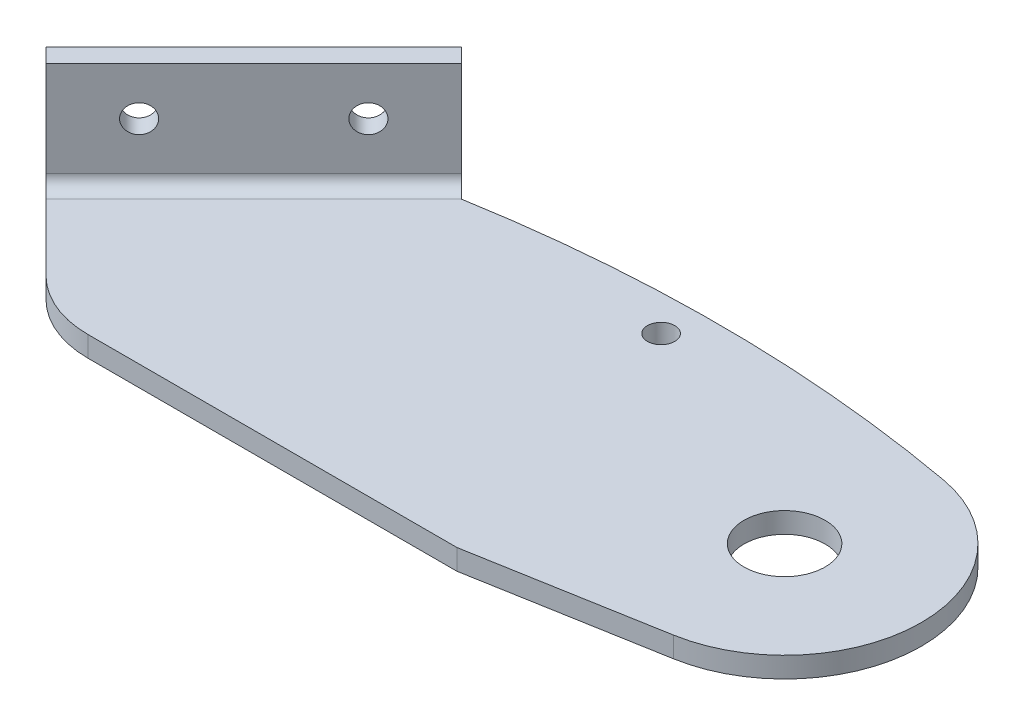
from build123d import *

# Parameters (mm, degrees)
SKETCH1_R                  = 4
BOSS_EXTRUDE1_DEPTH        = 2.032
BOSS_EXTRUDE3_DEPTH        = 10.668
SKETCH12_R                 = 1.36525
CUT_EXTRUDE2_DEPTH         = 4
CUT_EXTRUDE3_DEPTH         = 6
CUT_EXTRUDE3_DEPTH_BACK    = 1
SKETCH14_R                 = 1.35255
FILLET1_R                  = 10
FLATTEN_BENDS1_START       = 2
FLATTEN_BENDS1_DEPTH       = 10.668
FLATTEN_BENDS1_START_2     = -0.032
FLATTEN_BENDS1_2_OUTLINE_R = 1.36525
FLATTEN_BENDS1_2_DEPTH     = 2.032
PROCESS_BENDS1_START       = -9.067864684
PROCESS_BENDS1_OUTLINE_W   = 29
PROCESS_BENDS1_OUTLINE_H   = 2.032
PROCESS_BENDS1_DEPTH       = 9.398
PROCESS_BENDS1_START_2     = 0.620942425
PROCESS_BENDS1_2_OUTLINE_W = 29
PROCESS_BENDS1_2_OUTLINE_H = 10.668
PROCESS_BENDS1_2_OUTLINE_R = 1.36525
PROCESS_BENDS1_2_DEPTH     = 1.71084748
PROCESS_BENDS1_START_3     = 0.330135316
PROCESS_BENDS1_3_OUTLINE_W = 29
PROCESS_BENDS1_3_OUTLINE_H = 2.032
PROCESS_BENDS1_3_DEPTH     = 0.184274429
PROCESS_BENDS1_START_4     = 0.299789905
PROCESS_BENDS1_4_OUTLINE_W = 29
PROCESS_BENDS1_4_OUTLINE_H = 10.668
PROCESS_BENDS1_4_OUTLINE_R = 1.36525
PROCESS_BENDS1_4_DEPTH     = 3.302
PROCESS_BENDS1_START_5     = -6.292093187
PROCESS_BENDS1_5_DEPTH     = 29


with BuildPart() as part:
    # Sketch1 → Boss-Extrude1 (new body)
    with BuildSketch(Plane(origin=(0, 2, 0), x_dir=(1, 0, 0), z_dir=(0, 1, 0))):
        with BuildLine():
            Line((16.268898369, 15.844931419), (-4.237198285, -4.661165235))
            Line((-4.237198285, -4.661165235), (7.60163648, -16.5))
            Line((7.60163648, -16.5), (48.167251499, -16.5))
            Line((48.167251499, -16.5), (66.344250399, -13.294904666))
            ThreePointArc((66.344250399, -13.294904666), (77.499939542, -0.040402458), (66.423785357, 13.280634945))
            ThreePointArc((66.423785357, 13.280634945), (42.528480772, 15.498562339), (18.613829789, 13.5))
            Line((18.613829789, 13.5), (16.268898369, 15.844931419))
        make_face()
        with Locations(Location((64, 0, 0), (0, 0, 90))):
            Circle(SKETCH1_R, mode=Mode.SUBTRACT)
    extrude(amount=-BOSS_EXTRUDE1_DEPTH)

    # Sketch5 → Boss-Extrude3 (add)
    with BuildSketch(Plane(origin=(0, 2, 0), x_dir=(1, 0, 0), z_dir=(0, 1, 0))):
        Polygon((16.268898369, 15.844931419), (-4.237198285, -4.661165235), (-2.800357306, -6.098006215), (17.705739349, 14.40809044), align=None)
    extrude(amount=BOSS_EXTRUDE3_DEPTH)

    # Sketch12 → Cut-Extrude2 (cut)
    with BuildSketch(Plane(origin=(0.211983475, 0, 0.211983475), x_dir=(-0.7071067811865475, 0, 0.7071067811865477), z_dir=(-0.7071067811865477, 0, -0.7071067811865475))):
        with Locations((-16.207906813, 7.968)):
            Circle(SKETCH12_R)
        with Locations((-0.207906813, 7.968)):
            Circle(SKETCH12_R)
    extrude(amount=-CUT_EXTRUDE2_DEPTH, mode=Mode.SUBTRACT)

    # Sketch14 → Cut-Extrude3 (cut, two sides: drawn at the far end of the back side and taken through both)
    with BuildSketch(Plane(origin=(0, 0, 0), x_dir=(1, 0, 0), z_dir=(0, 1, 0)).offset(-CUT_EXTRUDE3_DEPTH_BACK)):
        with Locations(Location((39.946755384, 11.867587507, 0), (0, 0, 270))):
            Circle(SKETCH14_R)
    extrude(amount=CUT_EXTRUDE3_DEPTH + CUT_EXTRUDE3_DEPTH_BACK, mode=Mode.SUBTRACT)

    # Fillet1
    fillet1_edges = [part.edges().sort_by_distance(p)[0] for p in [
        (7.60163648, 0.984, 16.5),
    ]]
    fillet(fillet1_edges, radius=FILLET1_R)

    # Flatten-Bends1: read off the stored shape, not the designer's step
    # Flatten-Bends1 outline → Flatten-Bends1 (cut)
    with BuildSketch(Plane(origin=(0, 0, 0), x_dir=(1, 0, 0), z_dir=(0, 1, 0)).offset(FLATTEN_BENDS1_START)):
        Polygon((17.705739349, 14.40809044), (16.290355815, 15.823473974), (16.268898369, 15.844931419), (-4.237198285, -4.661165235), (-2.800357306, -6.098006215), align=None)
    extrude(amount=FLATTEN_BENDS1_DEPTH, mode=Mode.SUBTRACT)

    # Flatten-Bends1 2 outline → Flatten-Bends1 2 (add)
    with BuildSketch(Plane(origin=(0, 0, 0), x_dir=(1, 0, 0), z_dir=(0, 1, 0)).offset(FLATTEN_BENDS1_START_2)):
        Polygon((-4.237198285, -4.661165235), (16.268898369, 15.844931419), (9.644966285, 22.468863503), (-10.861130369, 1.962766849), align=None)
        with Locations((-2.94153442, 3.235559055)):
            Circle(FLATTEN_BENDS1_2_OUTLINE_R, mode=Mode.SUBTRACT)
        with Locations((8.372174079, 14.549267554)):
            Circle(FLATTEN_BENDS1_2_OUTLINE_R, mode=Mode.SUBTRACT)
    extrude(amount=FLATTEN_BENDS1_2_DEPTH)

    # Process-Bends1: read off the stored shape, not the designer's step
    # Process-Bends1 outline → Process-Bends1 (cut)
    with BuildSketch(Plane(origin=(0, 0, 0), x_dir=(0.7071067811865474, 0, -0.7071067811865477), z_dir=(0.7071067811865476, 0, 0.7071067811865476)).offset(PROCESS_BENDS1_START)):
        with Locations((8.207906813, 0.984)):
            Rectangle(PROCESS_BENDS1_OUTLINE_W, PROCESS_BENDS1_OUTLINE_H)
    extrude(amount=PROCESS_BENDS1_DEPTH, mode=Mode.SUBTRACT)

    # Process-Bends1 2 outline → Process-Bends1 2 (add)
    with BuildSketch(Plane(origin=(0, 0, 0), x_dir=(0.7071067811865474, 0, -0.7071067811865477), z_dir=(0.7071067811865476, 0, 0.7071067811865476)).offset(PROCESS_BENDS1_START_2)):
        with Locations((8.207906813, 7.334)):
            Rectangle(PROCESS_BENDS1_2_OUTLINE_W, PROCESS_BENDS1_2_OUTLINE_H)
        with Locations((0.207906813, 7.968)):
            Circle(PROCESS_BENDS1_2_OUTLINE_R, mode=Mode.SUBTRACT)
        with Locations((16.207906813, 7.968)):
            Circle(PROCESS_BENDS1_2_OUTLINE_R, mode=Mode.SUBTRACT)
    extrude(amount=PROCESS_BENDS1_2_DEPTH)

    # Process-Bends1 3 outline → Process-Bends1 3 (cut)
    with BuildSketch(Plane(origin=(0, 0, 0), x_dir=(0.7071067811865474, 0, -0.7071067811865477), z_dir=(0.7071067811865476, 0, 0.7071067811865476)).offset(PROCESS_BENDS1_START_3)):
        with Locations((8.207906813, 0.984)):
            Rectangle(PROCESS_BENDS1_3_OUTLINE_W, PROCESS_BENDS1_3_OUTLINE_H)
    extrude(amount=PROCESS_BENDS1_3_DEPTH, mode=Mode.SUBTRACT)

    # Process-Bends1 4 outline → Process-Bends1 4 (add)
    with BuildSketch(Plane(origin=(0, 0, 0), x_dir=(0.7071067811865474, 0, -0.7071067811865477), z_dir=(0.7071067811865476, 0, 0.7071067811865476)).offset(PROCESS_BENDS1_START_4)):
        with Locations((8.207906813, 7.334)):
            Rectangle(PROCESS_BENDS1_4_OUTLINE_W, PROCESS_BENDS1_4_OUTLINE_H)
        with Locations((0.207906813, 7.968)):
            Circle(PROCESS_BENDS1_4_OUTLINE_R, mode=Mode.SUBTRACT)
        with Locations((16.207906813, 7.968)):
            Circle(PROCESS_BENDS1_4_OUTLINE_R, mode=Mode.SUBTRACT)
    extrude(amount=PROCESS_BENDS1_4_DEPTH)

    # Process-Bends1 5 outline → Process-Bends1 5 (cut)
    with BuildSketch(Plane(origin=(0, 0, 0), x_dir=(0.707106781186548, 0, 0.707106781186547), z_dir=(0.707106781186547, 0, -0.707106781186548)).offset(PROCESS_BENDS1_START_5)):
        with BuildLine():
            ThreePointArc((3.601789905, -2), (2.703764293, -2.371974388), (2.331789905, -3.27))
            Line((2.331789905, -3.27), (2.331789905, -12.668))
            Line((2.331789905, -12.668), (3.601789905, -12.668))
            Line((3.601789905, -12.668), (3.601789905, -2))
        make_face()
        with BuildLine():
            Line((0.299789905, -2), (0.299789905, -3.27))
            ThreePointArc((0.299789905, -3.27), (1.266923314, -0.935133409), (3.601789905, 0.032))
            Line((3.601789905, 0.032), (0.514409745, 0.032))
            Line((0.514409745, 0.032), (0.514409745, -2))
            Line((0.514409745, -2), (0.299789905, -2))
        make_face()
    extrude(amount=PROCESS_BENDS1_5_DEPTH, mode=Mode.SUBTRACT)


solid = part.part
